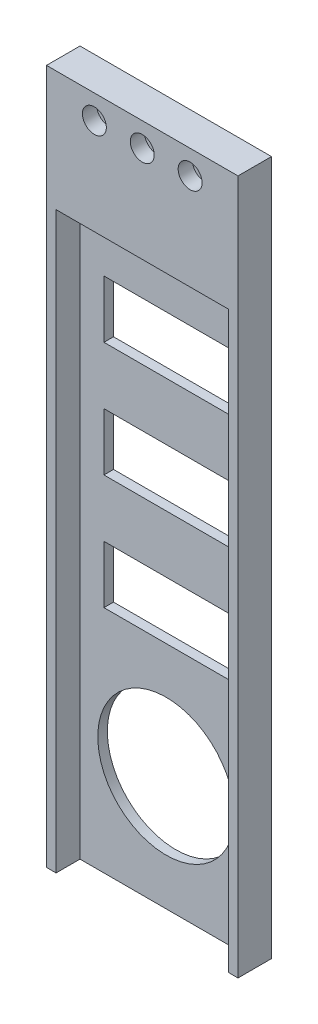
from build123d import *

# Parameters (mm, degrees)
SKETCH1_W           = 40
SKETCH1_H           = 145.1
BOSS_EXTRUDE1_DEPTH = 2
SKETCH2_R           = 14.29
CUT_EXTRUDE1_DEPTH  = 2
BOSS_EXTRUDE2_DEPTH = 5
SKETCH4_R           = 1.25
CUT_EXTRUDE2_DEPTH  = 7
SKETCH5_R           = 2.5
CUT_EXTRUDE3_DEPTH  = 3
SKETCH6_W           = 26
SKETCH6_H           = 12
CUT_EXTRUDE4_DEPTH  = 151.595517862


with BuildPart() as part:
    # Sketch1 → Boss-Extrude1 (new body)
    with BuildSketch(Plane.XY):
        with Locations((20, 72.55)):
            Rectangle(SKETCH1_W, SKETCH1_H)
    extrude(amount=BOSS_EXTRUDE1_DEPTH)

    # Sketch2 → Cut-Extrude1 (cut)
    with BuildSketch(Plane.XY.offset(2)):
        with Locations((20, 24)):
            Circle(SKETCH2_R)
    extrude(amount=-CUT_EXTRUDE1_DEPTH, mode=Mode.SUBTRACT)

    # Sketch3 → Boss-Extrude2 (add)
    with BuildSketch(Plane.XY.offset(2)):
        Polygon((0, 145.1), (40, 145.1), (40, 0), (38, 0), (38, 120), (2, 120), (2, 0), (0, 0), align=None)
    extrude(amount=BOSS_EXTRUDE2_DEPTH)

    # Sketch4 → Cut-Extrude2 (cut)
    with BuildSketch(Plane.XY.offset(7)):
        with Locations((20, 140.1)):
            Circle(SKETCH4_R)
        with Locations((10, 140.1)):
            Circle(SKETCH4_R)
        with Locations((30, 140.1)):
            Circle(SKETCH4_R)
    extrude(amount=-CUT_EXTRUDE2_DEPTH, mode=Mode.SUBTRACT)

    # Sketch5 → Cut-Extrude3 (cut)
    with BuildSketch(Plane.XY.offset(7)):
        with Locations((10, 140.1)):
            Circle(SKETCH5_R)
        with Locations((20, 140.1)):
            Circle(SKETCH5_R)
        with Locations((30, 140.1)):
            Circle(SKETCH5_R)
    extrude(amount=-CUT_EXTRUDE3_DEPTH, mode=Mode.SUBTRACT)

    # Sketch6 → Cut-Extrude4 (cut, through all)
    with BuildSketch(Plane.XY.offset(2)):
        with Locations((20, 102)):
            Rectangle(SKETCH6_W, SKETCH6_H)
        with Locations((20, 78)):
            Rectangle(SKETCH6_W, SKETCH6_H)
        with Locations((20, 54)):
            Rectangle(SKETCH6_W, SKETCH6_H)
    extrude(amount=-CUT_EXTRUDE4_DEPTH, mode=Mode.SUBTRACT)


solid = part.part
